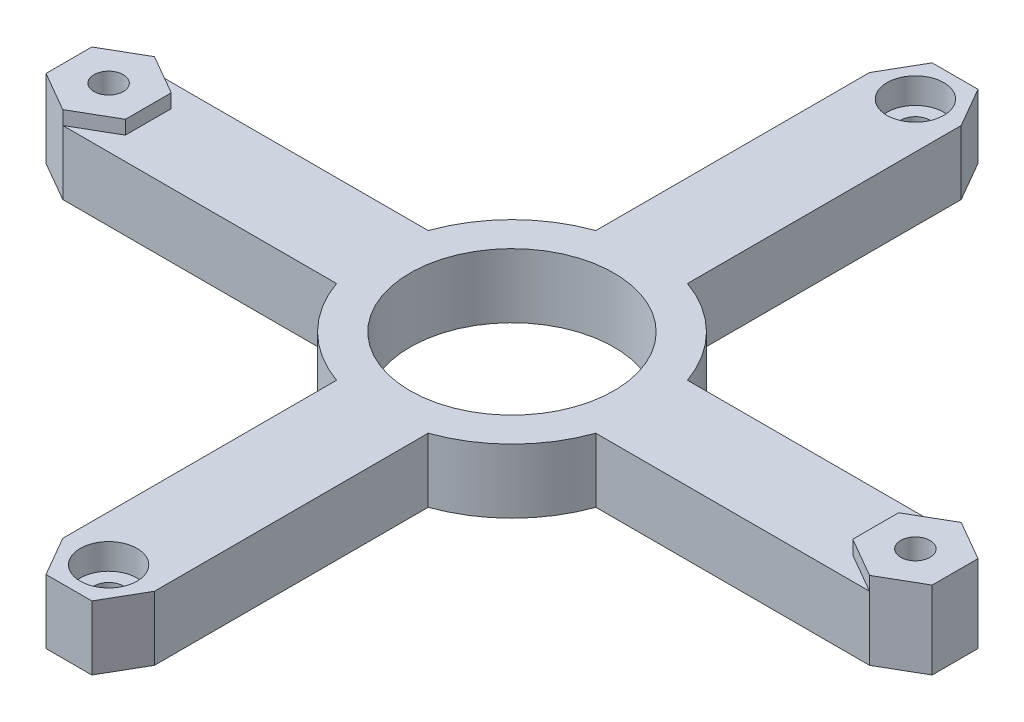
from build123d import *

# Parameters (mm, degrees)
SKETCH1_R           = 11.125
SKETCH1_R_2         = 1.6
BOSS_EXTRUDE1_DEPTH = 7
SKETCH2_R           = 1.6
BOSS_EXTRUDE2_DEPTH = 1.5
SKETCH3_R           = 3.1
CUT_EXTRUDE1_DEPTH  = 2.8


with BuildPart() as part:
    # Sketch1 → Boss-Extrude1 (new body)
    with BuildSketch(Plane(origin=(0, 0, 0), x_dir=(1, 0, 0), z_dir=(0, 1, 0))):
        with BuildLine():
            Line((44, 5), (48.330127019, 2.5))
            Line((48.330127019, 2.5), (48.330127019, -2.5))
            Line((48.330127019, -2.5), (44, -5))
            Line((44, -5), (14.142135624, -5))
            ThreePointArc((14.142135624, -5), (10.606601718, -10.606601718), (5, -14.142135624))
            Line((5, -14.142135624), (5, -44))
            Line((5, -44), (2.5, -48.330127019))
            Line((2.5, -48.330127019), (-2.5, -48.330127019))
            Line((-2.5, -48.330127019), (-5, -44))
            Line((-5, -44), (-5, -14.142135624))
            ThreePointArc((-5, -14.142135624), (-10.606601718, -10.606601718), (-14.142135624, -5))
            Line((-14.142135624, -5), (-44, -5))
            Line((-44, -5), (-48.330127019, -2.5))
            Line((-48.330127019, -2.5), (-48.330127019, 2.5))
            Line((-48.330127019, 2.5), (-44, 5))
            Line((-44, 5), (-14.142135624, 5))
            ThreePointArc((-14.142135624, 5), (-10.606601718, 10.606601718), (-5, 14.142135624))
            Line((-5, 14.142135624), (-5, 44))
            Line((-5, 44), (-2.5, 48.330127019))
            Line((-2.5, 48.330127019), (2.5, 48.330127019))
            Line((2.5, 48.330127019), (5, 44))
            Line((5, 44), (5, 14.142135624))
            ThreePointArc((5, 14.142135624), (10.606601718, 10.606601718), (14.142135624, 5))
            Line((14.142135624, 5), (44, 5))
        make_face()
        Circle(SKETCH1_R, mode=Mode.SUBTRACT)
        with Locations((44, 0)):
            Circle(SKETCH1_R_2, mode=Mode.SUBTRACT)
        with Locations((0, 44)):
            Circle(SKETCH1_R_2, mode=Mode.SUBTRACT)
        with Locations((-44, 0)):
            Circle(SKETCH1_R_2, mode=Mode.SUBTRACT)
        with Locations((0, -44)):
            Circle(SKETCH1_R_2, mode=Mode.SUBTRACT)
    extrude(amount=BOSS_EXTRUDE1_DEPTH)

    # Sketch2 → Boss-Extrude2 (add)
    # profile 1 of 2: a face of its own
    with BuildSketch(Plane(origin=(0, 7, 0), x_dir=(1, 0, 0), z_dir=(0, 1, 0))):
        Polygon((-44, 5), (-48.330127019, 2.5), (-48.330127019, -2.5), (-44, -5), (-39.669872981, -2.5), (-39.669872981, 2.5), align=None)
        with Locations((-44, 0)):
            Circle(SKETCH2_R, mode=Mode.SUBTRACT)
    # profile 2 of 2: a face of its own
    with BuildSketch(Plane(origin=(0, 7, 0), x_dir=(1, 0, 0), z_dir=(0, 1, 0))):
        Polygon((48.330127019, 2.5), (44, 5), (39.669872981, 2.5), (39.669872981, -2.5), (44, -5), (48.330127019, -2.5), align=None)
        with Locations((44, 0)):
            Circle(SKETCH2_R, mode=Mode.SUBTRACT)
    extrude(amount=BOSS_EXTRUDE2_DEPTH)

    # Sketch3 → Cut-Extrude1 (cut)
    with BuildSketch(Plane(origin=(0, 7, 0), x_dir=(1, 0, 0), z_dir=(0, 1, 0))):
        with Locations((0, 44)):
            Circle(SKETCH3_R)
        with Locations((0, -44)):
            Circle(SKETCH3_R)
    extrude(amount=-CUT_EXTRUDE1_DEPTH, mode=Mode.SUBTRACT)


solid = part.part
